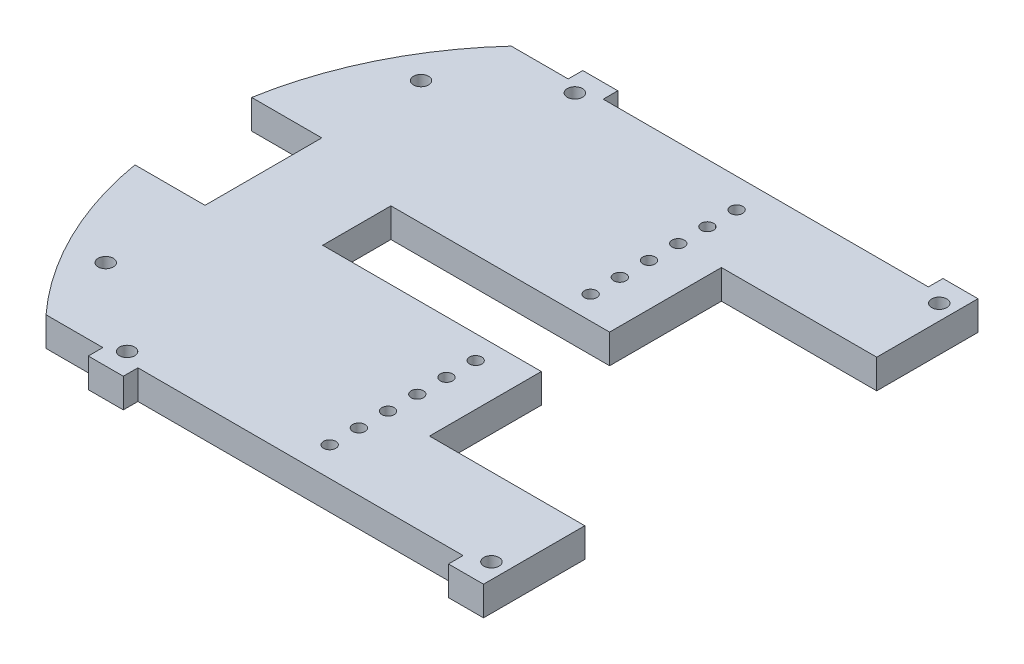
from build123d import *

# Parameters (mm, degrees)
SKETCH1_R           = 1.651
SKETCH1_R_2         = 1.3335
BOSS_EXTRUDE1_DEPTH = 6.35


with BuildPart() as part:
    # Sketch1 → Boss-Extrude1 (new body)
    with BuildSketch(Plane(origin=(0, 0, 0), x_dir=(1, 0, 0), z_dir=(0, 1, 0))):
        with BuildLine():
            Line((33.776652136, 18.187342636), (4.627239322, 18.187342636))
            Line((4.627239322, 18.187342636), (4.627239322, 33.034266248))
            Line((4.627239322, 33.034266248), (33.776652136, 33.034266248))
            Line((33.776652136, 33.034266248), (52.191652136, 33.034266248))
            Line((52.191652136, 33.034266248), (52.191652136, 57.360804442))
            Line((52.191652136, 57.360804442), (85.968304273, 57.360804442))
            Line((85.968304273, 57.360804442), (85.968304273, 76.214266248))
            Line((85.968304273, 76.214266248), (85.968304273, 79.389266248))
            Line((85.968304273, 79.389266248), (78.348304273, 79.389266248))
            Line((78.348304273, 79.389266248), (78.348304273, 76.214266248))
            Line((78.348304273, 76.214266248), (7.62, 76.214266248))
            Line((7.62, 76.214266248), (7.62, 79.389266248))
            Line((7.62, 79.389266248), (0, 79.389266248))
            Line((0, 79.389266248), (0, 76.214266248))
            Line((0, 76.214266248), (-12.371874213, 76.214266248))
            ThreePointArc((-12.371874213, 76.214266248), (-24.373410945, 58.595023332), (-30.932760678, 38.310804442))
            Line((-30.932760678, 38.310804442), (-15.692760678, 38.310804442))
            Line((-15.692760678, 38.310804442), (-15.692760678, 12.910804442))
            Line((-15.692760678, 12.910804442), (-30.932760678, 12.910804442))
            ThreePointArc((-30.932760678, 12.910804442), (-24.373410945, -7.373414447), (-12.371874213, -24.992657364))
            Line((-12.371874213, -24.992657364), (0, -24.992657364))
            Line((0, -24.992657364), (0, -28.167657364))
            Line((0, -28.167657364), (7.62, -28.167657364))
            Line((7.62, -28.167657364), (7.62, -24.992657364))
            Line((7.62, -24.992657364), (78.348304273, -24.992657364))
            Line((78.348304273, -24.992657364), (78.348304273, -28.167657364))
            Line((78.348304273, -28.167657364), (85.968304273, -28.167657364))
            Line((85.968304273, -28.167657364), (85.968304273, -24.992657364))
            Line((85.968304273, -24.992657364), (85.968304273, -6.139195558))
            Line((85.968304273, -6.139195558), (52.191652136, -6.139195558))
            Line((52.191652136, -6.139195558), (52.191652136, 18.187342636))
            Line((52.191652136, 18.187342636), (33.776652136, 18.187342636))
        make_face()
        with Locations((3.357239322, -23.087657364)):
            Circle(SKETCH1_R, mode=Mode.SUBTRACT)
        with Locations((82.611064951, -23.087657364)):
            Circle(SKETCH1_R, mode=Mode.SUBTRACT)
        with Locations((42.984152136, -12.292657364)):
            Circle(SKETCH1_R_2, mode=Mode.SUBTRACT)
        with Locations((42.984152136, -18.642657364)):
            Circle(SKETCH1_R_2, mode=Mode.SUBTRACT)
        with Locations((42.984152136, -5.942657364)):
            Circle(SKETCH1_R_2, mode=Mode.SUBTRACT)
        with Locations((42.984152136, 0.407342636)):
            Circle(SKETCH1_R_2, mode=Mode.SUBTRACT)
        with Locations((42.984152136, 6.757342636)):
            Circle(SKETCH1_R_2, mode=Mode.SUBTRACT)
        with Locations((42.984152136, 13.107342636)):
            Circle(SKETCH1_R_2, mode=Mode.SUBTRACT)
        with Locations((42.984152136, 38.114266248)):
            Circle(SKETCH1_R_2, mode=Mode.SUBTRACT)
        with Locations((82.611064951, 74.309266248)):
            Circle(SKETCH1_R, mode=Mode.SUBTRACT)
        with Locations((3.357239322, 74.309266248)):
            Circle(SKETCH1_R, mode=Mode.SUBTRACT)
        with Locations((-15.692760678, 59.900804442)):
            Circle(SKETCH1_R, mode=Mode.SUBTRACT)
        with Locations((-15.692760678, -8.679195558)):
            Circle(SKETCH1_R, mode=Mode.SUBTRACT)
        with Locations((42.984152136, 44.464266248)):
            Circle(SKETCH1_R_2, mode=Mode.SUBTRACT)
        with Locations((42.984152136, 50.814266248)):
            Circle(SKETCH1_R_2, mode=Mode.SUBTRACT)
        with Locations((42.984152136, 57.164266248)):
            Circle(SKETCH1_R_2, mode=Mode.SUBTRACT)
        with Locations((42.984152136, 63.514266248)):
            Circle(SKETCH1_R_2, mode=Mode.SUBTRACT)
        with Locations((42.984152136, 69.864266248)):
            Circle(SKETCH1_R_2, mode=Mode.SUBTRACT)
    extrude(amount=BOSS_EXTRUDE1_DEPTH)


solid = part.part
